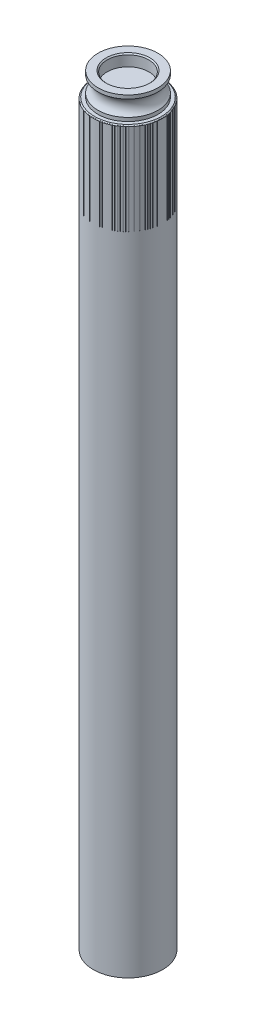
from build123d import *

# Parameters (mm, degrees)
SKETCH2_R          = 4.25
SKETCH3_R          = 9
CUT_EXTRUDE1_DEPTH = 5
CHAMFER1_SIZE      = 0.5
SKETCH4_W          = 0.1
SKETCH4_H          = 0.4
CUT_EXTRUDE2_DEPTH = 40
CIRPATTERN1_COUNT  = 110


with BuildPart() as part:
    # Sketch1 → Revolve1 (revolve)
    with BuildSketch(Plane.XY):
        Polygon((0, 0), (0, 330), (-13, 330), (-13, 320), (-15, 320), (-15, 0), align=None)
    revolve(axis=Axis((0, 0, 0), (0, 1, 0)))

    # Sketch2 → Cut-Revolve1 (revolve, cut)
    with BuildSketch(Plane.XY):
        with Locations((-15.5, 325)):
            Circle(SKETCH2_R)
    revolve(axis=Axis((0, 0, 0), (0, 1, 0)), mode=Mode.SUBTRACT)

    # Sketch3 → Cut-Extrude1 (cut)
    with BuildSketch(Plane(origin=(0, 330, 0), x_dir=(1, 0, 0), z_dir=(0, 1, 0))):
        Circle(SKETCH3_R)
    extrude(amount=-CUT_EXTRUDE1_DEPTH, mode=Mode.SUBTRACT)

    # Chamfer1
    chamfer1_edges = [part.edges().sort_by_distance(p)[0] for p in [
        (15, 320, 0),
        (-9, 330, 0),
    ]]
    chamfer(chamfer1_edges, length=CHAMFER1_SIZE)

    # Sketch4 → Cut-Extrude2 (cut)
    with BuildSketch(Plane(origin=(0, 320, 0), x_dir=(1, 0, 0), z_dir=(0, 1, 0))):
        with Locations((0, 15)):
            Rectangle(SKETCH4_W, SKETCH4_H)
    cut_extrude2 = extrude(amount=-CUT_EXTRUDE2_DEPTH, mode=Mode.SUBTRACT)

    # CirPattern1: Cut-Extrude2 ×110 about axis
    cirpattern1_axis = Axis((0, 330, 0), (0, -1, 0))
    for i in range(1, CIRPATTERN1_COUNT):
        add(cut_extrude2.rotate(cirpattern1_axis, i * 360 / CIRPATTERN1_COUNT), mode=Mode.SUBTRACT)


solid = part.part
